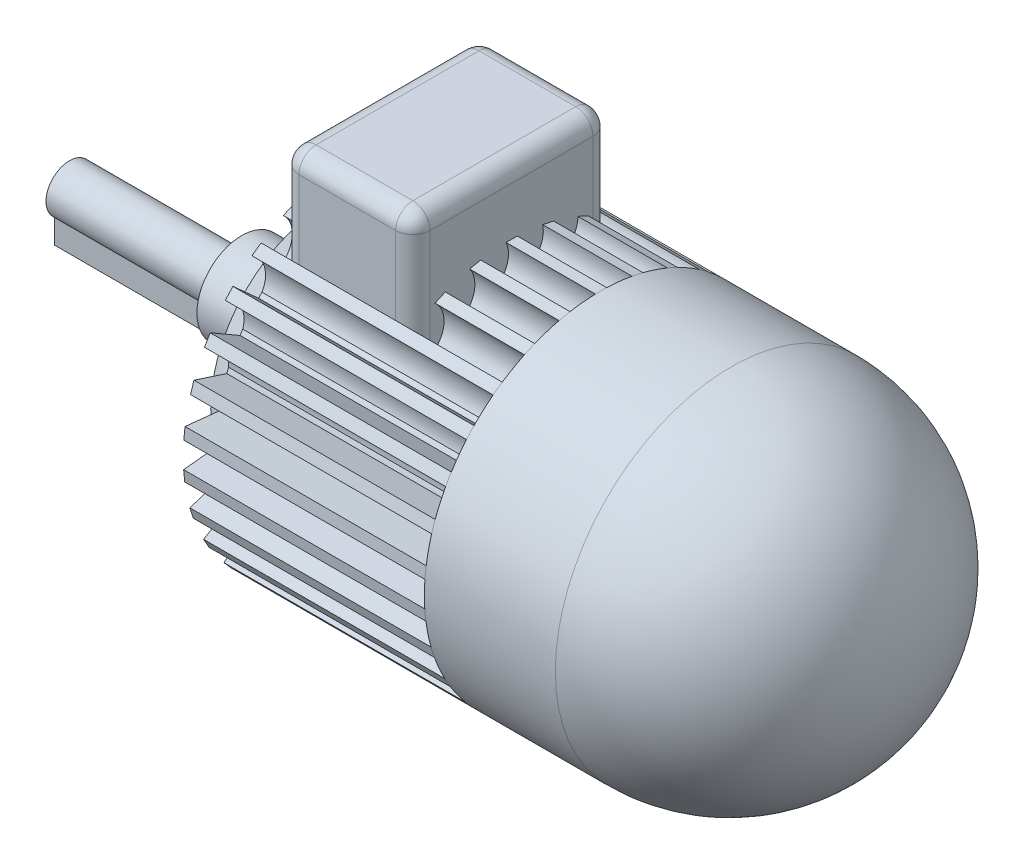
from build123d import *

# Parameters (mm, degrees)
BOSS_EXTRUDE2_DEPTH = 70
CIRPATTERN2_COUNT   = 30
BOSS_EXTRUDE3_REACH = 234.605
SKETCH4_W           = 38.065900112
SKETCH4_H           = 57.26566794
FILLET1_R           = 5
SKETCH6_R           = 6.809817483
BOSS_EXTRUDE4_DEPTH = 50
BOSS_EXTRUDE5_REACH = 259.038
SKETCH7_W           = 8.635431536
SKETCH7_H           = 6.996010078


with BuildPart() as part:
    # Sketch1 → Revolve2 (revolve)
    with BuildSketch(Plane.XY, mode=Mode.PRIVATE) as revolve2_sk:
        with BuildLine():
            Line((0, 0), (0, 13))
            Line((0, 13), (26, 13))
            Line((26, 13), (26, 35))
            Line((26, 35), (34.009742404, 40.986988109))
            Line((34.009742404, 40.986988109), (104.009742404, 40.986988109))
            Line((104.009742404, 40.986988109), (104.009742404, 50.986988109))
            Line((104.009742404, 50.986988109), (142.009742404, 50.986988109))
            ThreePointArc((142.009742404, 50.986988109), (177.712329184, 35.991634904), (192, 0))
            Line((192, 0), (0, 0))
        make_face()
    revolve(revolve2_sk.sketch.rotate(Axis((0, 0, 0), (1, 0, 0)), 90), axis=Axis((0, 0, 0), (1, 0, 0)))

    # Sketch3 → Boss-Extrude2 (add)
    with BuildSketch(Plane.ZY.offset(-104.009742404)):
        with BuildLine():
            Line((-1.925622889, 40.941728966), (-1.925622889, 50.950612684))
            Line((-1.925622889, 50.950612684), (1.339338107, 50.96939405))
            ThreePointArc((1.339338107, 50.96939405), (1.140506, 45.009096947), (5.214476968, 40.653934916))
            ThreePointArc((5.214476968, 40.653934916), (1.65071095, 40.953734233), (-1.925622889, 40.941728966))
        make_face()
    boss_extrude2 = extrude(amount=BOSS_EXTRUDE2_DEPTH)

    # CirPattern2: Boss-Extrude2 ×30 about axis
    cirpattern2_axis = Axis((0, 0, 0), (1, 0, 0))
    for i in range(1, CIRPATTERN2_COUNT):
        add(boss_extrude2.rotate(cirpattern2_axis, i * 360 / CIRPATTERN2_COUNT))

    # Sketch4 → Boss-Extrude3 (add, up to next)
    with BuildSketch(Plane(origin=(0, 70, 0), x_dir=(1, 0, 0), z_dir=(0, 1, 0)), mode=Mode.PRIVATE) as boss_extrude3_sk1:
        with Locations((59.030031922, 0.242676881)):
            Rectangle(SKETCH4_W, SKETCH4_H)
    boss_extrude3_tool1 = extrude(boss_extrude3_sk1.sketch, amount=-BOSS_EXTRUDE3_REACH, mode=Mode.PRIVATE) - part.part
    add(boss_extrude3_tool1.solids().sort_by_distance((59.030032, 70, -0.242677))[0])

    # Fillet1
    # the kernel refuses this fillet: 5 mm, written as the material it takes off along each edge
    with BuildSketch(Plane(origin=(44.997081866, 65, -23.875510851), x_dir=(0, 1, 0), z_dir=(0, 0, -1))) as fillet1_piece_1_section:
        Polygon((0, 0), (FILLET1_R * 1.02, 0), (FILLET1_R * 1.02, -FILLET1_R * 1.02), (0, -FILLET1_R * 1.02), align=None)
    fillet1_piece_1 = extrude(amount=FILLET1_R * 1.02, mode=Mode.PRIVATE)
    fillet1_piece_1 = fillet1_piece_1 - Plane(origin=(44.997081866, 65, -23.875510851), x_dir=(0.7071067811865475, -0.7071067811865475, 0), z_dir=(0, 0, -1)) * Sphere(FILLET1_R, mode=Mode.PRIVATE)
    add(fillet1_piece_1, mode=Mode.SUBTRACT)
    with BuildSketch(Plane(origin=(73.062981978, 65, 23.390157089), x_dir=(0, 0, 1), z_dir=(0, 1, 0))) as fillet1_piece_2_section:
        Polygon((0, 0), (FILLET1_R * 1.02, 0), (FILLET1_R * 1.02, FILLET1_R * 1.02), (0, FILLET1_R * 1.02), align=None)
    fillet1_piece_2 = extrude(amount=FILLET1_R * 1.02, mode=Mode.PRIVATE)
    fillet1_piece_2 = fillet1_piece_2 - Plane(origin=(73.062981978, 65, 23.390157089), x_dir=(-0.7071067811865475, 0, -0.7071067811865475), z_dir=(0, 1, 0)) * Sphere(FILLET1_R, mode=Mode.PRIVATE)
    add(fillet1_piece_2, mode=Mode.SUBTRACT)
    with BuildSketch(Plane(origin=(73.062981978, 65, -23.875510851), x_dir=(0, 1, 0), z_dir=(0, 0, -1))) as fillet1_piece_3_section:
        Polygon((0, 0), (FILLET1_R * 1.02, 0), (FILLET1_R * 1.02, FILLET1_R * 1.02), (0, FILLET1_R * 1.02), align=None)
    fillet1_piece_3 = extrude(amount=FILLET1_R * 1.02, mode=Mode.PRIVATE)
    fillet1_piece_3 = fillet1_piece_3 - Plane(origin=(73.062981978, 65, -23.875510851), x_dir=(-0.7071067811865475, -0.7071067811865475, 0), z_dir=(0, 0, -1)) * Sphere(FILLET1_R, mode=Mode.PRIVATE)
    add(fillet1_piece_3, mode=Mode.SUBTRACT)
    with BuildSketch(Plane(origin=(44.997081866, 65, 23.390157089), x_dir=(0, 1, 0), z_dir=(0, 0, 1))) as fillet1_piece_4_section:
        Polygon((0, 0), (FILLET1_R * 1.02, 0), (FILLET1_R * 1.02, FILLET1_R * 1.02), (0, FILLET1_R * 1.02), align=None)
    fillet1_piece_4 = extrude(amount=FILLET1_R * 1.02, mode=Mode.PRIVATE)
    fillet1_piece_4 = fillet1_piece_4 - Plane(origin=(44.997081866, 65, 23.390157089), x_dir=(0.7071067811865475, -0.7071067811865475, 0), z_dir=(0, 0, 1)) * Sphere(FILLET1_R, mode=Mode.PRIVATE)
    add(fillet1_piece_4, mode=Mode.SUBTRACT)
    with BuildSketch(Plane(origin=(39.997081866, 65, -28.875510851), x_dir=(0, 0, 1), z_dir=(0, -1, 0))) as fillet1_piece_5_section:
        with BuildLine():
            CenterArc((FILLET1_R, -FILLET1_R), FILLET1_R, 90, 90)
            Line((0, -FILLET1_R), (0, 0))
            Line((0, 0), (FILLET1_R, 0))
        make_face()
    fillet1_piece_5 = extrude(amount=35.477650833, mode=Mode.PRIVATE)
    fillet1_piece_5 = split(fillet1_piece_5, bisect_by=Plane(origin=(41.156851381, 47.513303453, -21.40856636), z_dir=(0, 0.8056224887442456, -0.5924292410318114)), keep=Keep.TOP, mode=Mode.PRIVATE)
    add(fillet1_piece_5, mode=Mode.SUBTRACT)
    with BuildSketch(Plane(origin=(39.997081866, 65, -28.875510851), x_dir=(0, 0, 1), z_dir=(0, -1, 0))) as fillet1_piece_6_section:
        with BuildLine():
            CenterArc((FILLET1_R, -FILLET1_R), FILLET1_R, 90, 90)
            Line((0, -FILLET1_R), (0, 0))
            Line((0, 0), (FILLET1_R, 0))
        make_face()
    fillet1_piece_6 = extrude(amount=35.477650833, mode=Mode.PRIVATE)
    fillet1_piece_6 = fillet1_piece_6 & Plane(origin=(40.041738577, 43.587697003, -21.242530744), x_dir=(0, -0.2008959060873956, -0.979612594303138), z_dir=(1, 0, 0)) * Cylinder(7.791835417, 91, mode=Mode.PRIVATE)
    add(fillet1_piece_6, mode=Mode.SUBTRACT)
    with BuildSketch(Plane(origin=(78.062981978, 70, 23.390157089), x_dir=(-1, 0, 0), z_dir=(0, 0, -1))) as fillet1_piece_7:
        with BuildLine():
            CenterArc((FILLET1_R, -FILLET1_R), FILLET1_R, 90, 90)
            Line((0, -FILLET1_R), (0, 0))
            Line((0, 0), (FILLET1_R, 0))
        make_face()
    extrude(amount=47.26566794, mode=Mode.SUBTRACT)
    with BuildSketch(Plane(origin=(73.062981978, 70, -28.875510851), x_dir=(0, -1, 0), z_dir=(-1, 0, 0))) as fillet1_piece_8:
        with BuildLine():
            CenterArc((FILLET1_R, FILLET1_R), FILLET1_R, 180, 90)
            Line((0, FILLET1_R), (0, 0))
            Line((0, 0), (FILLET1_R, 0))
        make_face()
    extrude(amount=28.065900111, mode=Mode.SUBTRACT)
    with BuildSketch(Plane(origin=(39.997081866, 70, -23.875510851), x_dir=(0, -1, 0), z_dir=(0, 0, 1))) as fillet1_piece_9:
        with BuildLine():
            CenterArc((FILLET1_R, FILLET1_R), FILLET1_R, 180, 90)
            Line((0, FILLET1_R), (0, 0))
            Line((0, 0), (FILLET1_R, 0))
        make_face()
    extrude(amount=47.26566794, mode=Mode.SUBTRACT)
    with BuildSketch(Plane(origin=(44.997081866, 70, 28.390157089), x_dir=(0, 0, -1), z_dir=(1, 0, 0))) as fillet1_piece_10:
        with BuildLine():
            CenterArc((FILLET1_R, -FILLET1_R), FILLET1_R, 90, 90)
            Line((0, -FILLET1_R), (0, 0))
            Line((0, 0), (FILLET1_R, 0))
        make_face()
    extrude(amount=28.065900111, mode=Mode.SUBTRACT)
    with BuildSketch(Plane(origin=(78.062981978, 65, -28.875510851), x_dir=(-1, 0, 0), z_dir=(0, -1, 0))) as fillet1_piece_11_section:
        with BuildLine():
            CenterArc((FILLET1_R, -FILLET1_R), FILLET1_R, 90, 90)
            Line((0, -FILLET1_R), (0, 0))
            Line((0, 0), (FILLET1_R, 0))
        make_face()
    fillet1_piece_11 = extrude(amount=35.477650833, mode=Mode.PRIVATE)
    fillet1_piece_11 = split(fillet1_piece_11, bisect_by=Plane(origin=(76.903212432, 47.513303552, -21.408566225), z_dir=(0, 0.8056224887442456, -0.5924292410318114)), keep=Keep.TOP, mode=Mode.PRIVATE)
    add(fillet1_piece_11, mode=Mode.SUBTRACT)
    with BuildSketch(Plane(origin=(78.062981978, 65, -28.875510851), x_dir=(-1, 0, 0), z_dir=(0, -1, 0))) as fillet1_piece_12_section:
        with BuildLine():
            CenterArc((FILLET1_R, -FILLET1_R), FILLET1_R, 90, 90)
            Line((0, -FILLET1_R), (0, 0))
            Line((0, 0), (FILLET1_R, 0))
        make_face()
    fillet1_piece_12 = extrude(amount=35.477650833, mode=Mode.PRIVATE)
    fillet1_piece_12 = fillet1_piece_12 & Plane(origin=(78.018325267, 43.587697003, -21.242530744), x_dir=(0, -0.2008959060873956, -0.979612594303138), z_dir=(1, 0, 0)) * Cylinder(7.791835417, 91, mode=Mode.PRIVATE)
    add(fillet1_piece_12, mode=Mode.SUBTRACT)
    with BuildSketch(Plane(origin=(39.997081866, 65, 28.390157089), x_dir=(0, 0, -1), z_dir=(0, -1, 0))) as fillet1_piece_13_section:
        with BuildLine():
            CenterArc((FILLET1_R, FILLET1_R), FILLET1_R, 180, 90)
            Line((0, FILLET1_R), (0, 0))
            Line((0, 0), (FILLET1_R, 0))
        make_face()
    fillet1_piece_13 = extrude(amount=35.148235729, mode=Mode.PRIVATE)
    fillet1_piece_13 = split(fillet1_piece_13, bisect_by=Plane(origin=(41.130910811, 49.501701511, 33.584890566), z_dir=(0, 0.5877852522924731, -0.8090169943749475)), keep=Keep.TOP, mode=Mode.PRIVATE)
    add(fillet1_piece_13, mode=Mode.SUBTRACT)
    with BuildSketch(Plane(origin=(78.062981978, 65, 28.390157089), x_dir=(-1, 0, 0), z_dir=(0, -1, 0))) as fillet1_piece_14_section:
        with BuildLine():
            CenterArc((FILLET1_R, FILLET1_R), FILLET1_R, 180, 90)
            Line((0, FILLET1_R), (0, 0))
            Line((0, 0), (FILLET1_R, 0))
        make_face()
    fillet1_piece_14 = extrude(amount=35.148235729, mode=Mode.PRIVATE)
    fillet1_piece_14 = split(fillet1_piece_14, bisect_by=Plane(origin=(76.929153033, 49.501701511, 33.584890566), z_dir=(0, 0.5877852522924731, -0.8090169943749475)), keep=Keep.TOP, mode=Mode.PRIVATE)
    add(fillet1_piece_14, mode=Mode.SUBTRACT)

    # Sketch6 → Boss-Extrude4 (add)
    with BuildSketch(Plane.ZY):
        Circle(SKETCH6_R)
    extrude(amount=BOSS_EXTRUDE4_DEPTH)

    # Sketch7 → Boss-Extrude5 (add, up to next)
    with BuildSketch(Plane.ZY.offset(50), mode=Mode.PRIVATE) as boss_extrude5_sk1:
        with Locations((0, -8.764022956)):
            Rectangle(SKETCH7_W, SKETCH7_H)
    boss_extrude5_tool1 = extrude(boss_extrude5_sk1.sketch, amount=-BOSS_EXTRUDE5_REACH, mode=Mode.PRIVATE) - part.part
    add(boss_extrude5_tool1.solids().sort_by_distance((-50, -8.764023, 0))[0])


solid = part.part
